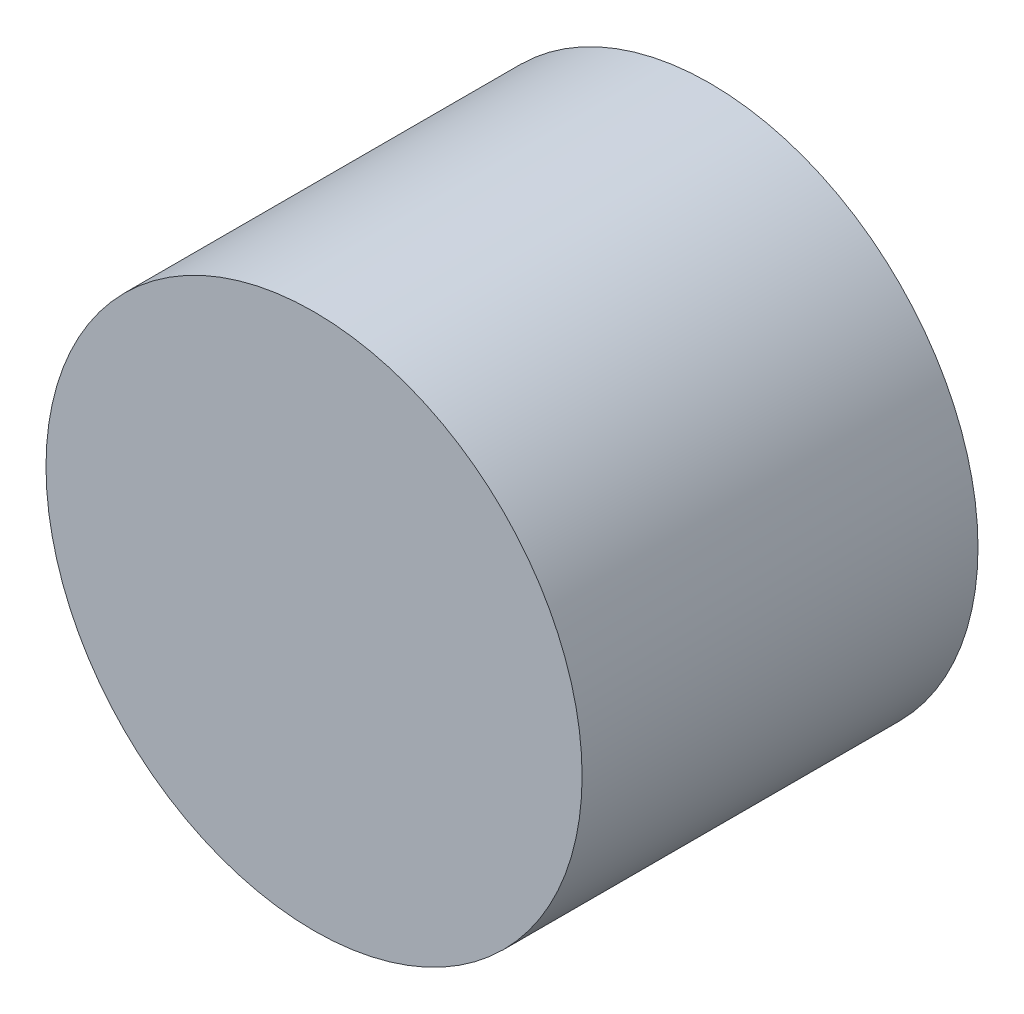
from build123d import *

# Parameters (mm, degrees)
SKETCH1_R           = 103.1875
BOSS_EXTRUDE1_DEPTH = 152.4
SKETCH2_R           = 101.6
CUT_EXTRUDE1_DEPTH  = 149.225
SKETCH3_R           = 6.35
CUT_EXTRUDE2_DEPTH  = 212.000190314


with BuildPart() as part:
    # Sketch1 → Boss-Extrude1 (new body)
    with BuildSketch(Plane.XY):
        Circle(SKETCH1_R)
    extrude(amount=BOSS_EXTRUDE1_DEPTH)

    # Sketch2 → Cut-Extrude1 (cut)
    with BuildSketch(Plane(origin=(0, 0, 0), x_dir=(-1, 0, 0), z_dir=(0, 0, -1))):
        Circle(SKETCH2_R)
    extrude(amount=-CUT_EXTRUDE1_DEPTH, mode=Mode.SUBTRACT)

    # Sketch3 → Cut-Extrude2 (cut, through all)
    with BuildSketch(Plane(origin=(0, 0, 0), x_dir=(0, 0, -1), z_dir=(1, 0, 0))):
        with Locations((-142.875, 0)):
            Circle(SKETCH3_R)
    extrude(amount=-CUT_EXTRUDE2_DEPTH, mode=Mode.SUBTRACT)


solid = part.part
